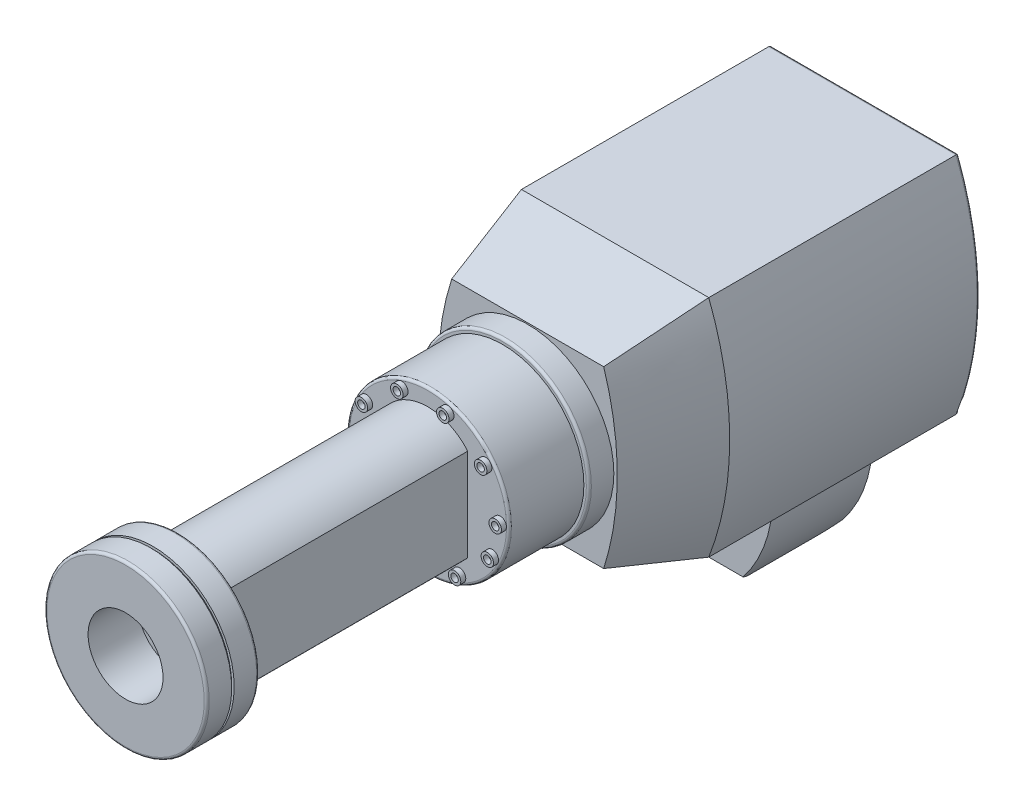
from build123d import *

# Parameters (mm, degrees)
SALIENTE_EXTRUIR1_DEPTH  = 100
CROQUIS4_R               = 34.5
SALIENTE_EXTRUIR2_DEPTH  = 10
CROQUIS6_R               = 32.5
SALIENTE_EXTRUIR4_DEPTH  = 30
CROQUIS7_R               = 2.5
CROQUIS7_R_2             = 1.5
SALIENTE_EXTRUIR5_DEPTH  = 2
MATRIZC1_COUNT           = 10
MATRIZC1_ANGLE           = 333
SALIENTE_EXTRUIR6_DEPTH  = 100
CROQUIS9_R               = 32.5
SALIENTE_EXTRUIR7_DEPTH  = 10
CROQUIS10_R              = 31.5
SALIENTE_EXTRUIR8_DEPTH  = 1
CROQUIS11_R              = 32.5
SALIENTE_EXTRUIR9_DEPTH  = 10
CROQUIS12_R              = 42.5
SALIENTE_EXTRUIR10_DEPTH = 10.5
SALIENTE_EXTRUIR11_DEPTH = 35
SALIENTE_EXTRUIR12_DEPTH = 20
CORTAR_EXTRUIR1_DEPTH    = 40
REDONDEO1_R              = 1
REDONDEO2_R              = 1
REDONDEO3_R              = 1
REDONDEO4_R              = 1
CROQUIS16_R              = 15
CORTAR_EXTRUIR2_DEPTH    = 20
CROQUIS17_R              = 15
CORTAR_EXTRUIR3_DEPTH    = 20


with BuildPart() as part:
    # Croquis1 → Saliente-Extruir1 (new body)
    with BuildSketch(Plane.XY):
        with BuildLine():
            Line((37.5, 45), (-37.5, 45))
            ThreePointArc((-37.5, 45), (-45.880962103, 0), (-37.5, -45))
            Line((-37.5, -45), (37.5, -45))
            ThreePointArc((37.5, -45), (45.880962103, 0), (37.5, 45))
        make_face()
    extrude(amount=SALIENTE_EXTRUIR1_DEPTH)

    # Croquis3 for Recubrir1 → Recubrir1 section 0
    with BuildSketch(Plane.XY.offset(135)):
        with BuildLine():
            Line((30.425473604, 35), (-30.425473604, 35))
            # circular arc as an exact rational Bezier (weights 1, cos(half-angle), 1)
            Bezier((-30.425473604, 35), (-41.608142487, 0), (-30.425473604, -35), weights=[1, 0.95256097, 1])
            Line((-30.425473604, -35), (30.425473604, -35))
            Bezier((30.425473604, -35), (41.608142487, 0), (30.425473604, 35), weights=[1, 0.95256097, 1])
        make_face()
    # Croquis2 for Recubrir1 → Recubrir1 section 1
    with BuildSketch(Plane.XY.offset(100)):
        with BuildLine():
            Line((-37.5, -45), (37.5, -45))
            Bezier((37.5, -45), (54.864231746, 0), (37.5, 45), weights=[1, 0.932952303, 1])
            Line((37.5, 45), (-37.5, 45))
            Bezier((-37.5, 45), (-54.864231746, 0), (-37.5, -45), weights=[1, 0.932952303, 1])
        make_face()
    loft()

    # Croquis4 → Saliente-Extruir2 (add)
    with BuildSketch(Plane.XY.offset(135)):
        Circle(CROQUIS4_R)
    extrude(amount=SALIENTE_EXTRUIR2_DEPTH)

    # Croquis6 → Saliente-Extruir4 (add)
    with BuildSketch(Plane.XY.offset(145)):
        Circle(CROQUIS6_R)
    extrude(amount=SALIENTE_EXTRUIR4_DEPTH)

    # Croquis7 → Saliente-Extruir5 (add)
    with BuildSketch(Plane.XY.offset(175)):
        with Locations((29, 0)):
            Circle(CROQUIS7_R)
        with Locations((29, 0)):
            Circle(CROQUIS7_R_2, mode=Mode.SUBTRACT)
    saliente_extruir5 = extrude(amount=SALIENTE_EXTRUIR5_DEPTH)

    # MatrizC1: Saliente-Extruir5 ×10 about axis
    matrizc1_axis = Axis((0, 0, 0), (0, 0, 1))
    for i in range(1, MATRIZC1_COUNT):
        add(saliente_extruir5.rotate(matrizc1_axis, i * MATRIZC1_ANGLE / (MATRIZC1_COUNT - 1)))

    # Croquis8 → Saliente-Extruir6 (add)
    with BuildSketch(Plane.XY.offset(175)):
        with BuildLine():
            Line((16, -18.5), (16, 18.5))
            ThreePointArc((16, 18.5), (0, 25.898529491), (-16, 18.5))
            Line((-16, 18.5), (-16, -18.5))
            ThreePointArc((-16, -18.5), (0, -25.898529491), (16, -18.5))
        make_face()
    extrude(amount=SALIENTE_EXTRUIR6_DEPTH)

    # Croquis9 → Saliente-Extruir7 (add)
    with BuildSketch(Plane.XY.offset(275)):
        Circle(CROQUIS9_R)
    extrude(amount=SALIENTE_EXTRUIR7_DEPTH)

    # Croquis10 → Saliente-Extruir8 (add)
    with BuildSketch(Plane.XY.offset(285)):
        Circle(CROQUIS10_R)
    extrude(amount=SALIENTE_EXTRUIR8_DEPTH)

    # Croquis11 → Saliente-Extruir9 (add)
    with BuildSketch(Plane.XY.offset(286)):
        Circle(CROQUIS11_R)
    extrude(amount=SALIENTE_EXTRUIR9_DEPTH)

    # Croquis12 → Saliente-Extruir10 (add, symmetric)
    with BuildSketch(Plane(origin=(-37.5, 0, 0), x_dir=(0, 0, -1), z_dir=(1, 0, 0))):
        with Locations((-50, -45)):
            Circle(CROQUIS12_R)
    extrude(amount=SALIENTE_EXTRUIR10_DEPTH, both=True)

    # Croquis13 → Saliente-Extruir11 (add)
    with BuildSketch(Plane(origin=(-27, 0, 0), x_dir=(0, 0, -1), z_dir=(1, 0, 0))):
        with BuildLine():
            Line((-70, -45), (-70, -75))
            ThreePointArc((-70, -75), (-50, -82.639320225), (-30, -75))
            Line((-30, -75), (-30, -45))
            Line((-30, -45), (-70, -45))
        make_face()
    extrude(amount=SALIENTE_EXTRUIR11_DEPTH)

    # Croquis14 → Saliente-Extruir12 (add, symmetric)
    with BuildSketch(Plane.XY.offset(50)):
        with BuildLine():
            Line((8, -45), (8, -87))
            ThreePointArc((8, -87), (25.421855105, -68.929675658), (33, -45))
            Line((33, -45), (8, -45))
        make_face()
    extrude(amount=SALIENTE_EXTRUIR12_DEPTH, both=True)

    # Croquis15 → Cortar-Extruir1 (cut)
    with BuildSketch(Plane.ZY.offset(-8)):
        with BuildLine():
            Line((70, -87), (70, -75))
            ThreePointArc((70, -75), (50, -82.639320225), (30, -75))
            Line((30, -75), (30, -87))
            Line((30, -87), (70, -87))
        make_face()
    extrude(amount=-CORTAR_EXTRUIR1_DEPTH, mode=Mode.SUBTRACT)

    # Redondeo1
    redondeo1_edges = [part.edges().sort_by_distance(p)[0] for p in [
        (0, 45, 0),
        (45.880962103, 0, 0),
        (0, -45, 0),
        (-45.880962103, 0, 0),
    ]]
    fillet(redondeo1_edges, radius=REDONDEO1_R)

    # Redondeo2
    redondeo2_edges = [part.edges().sort_by_distance(p)[0] for p in [
        (-48, -45, 92.5),
        (-27, -87.5, 50),
    ]]
    fillet(redondeo2_edges, radius=REDONDEO2_R)

    # Redondeo3
    redondeo3_edges = [part.edges().sort_by_distance(p)[0] for p in [
        (-34.5, 0, 145),
        (-32.5, 0, 175),
    ]]
    fillet(redondeo3_edges, radius=REDONDEO3_R - 0.0001)  # a hair under: the kernel refuses the full size

    # Redondeo4
    redondeo4_edges = [part.edges().sort_by_distance(p)[0] for p in [
        (-32.5, 0, 275),
        (-32.5, 0, 296),
    ]]
    fillet(redondeo4_edges, radius=REDONDEO4_R)

    # Croquis16 → Cortar-Extruir2 (cut)
    with BuildSketch(Plane.XY.offset(296)):
        Circle(CROQUIS16_R)
    extrude(amount=-CORTAR_EXTRUIR2_DEPTH, mode=Mode.SUBTRACT)

    # Croquis17 → Cortar-Extruir3 (cut)
    with BuildSketch(Plane.ZY.offset(48)):
        with Locations((50, -45)):
            Circle(CROQUIS17_R)
    extrude(amount=-CORTAR_EXTRUIR3_DEPTH, mode=Mode.SUBTRACT)


solid = part.part
